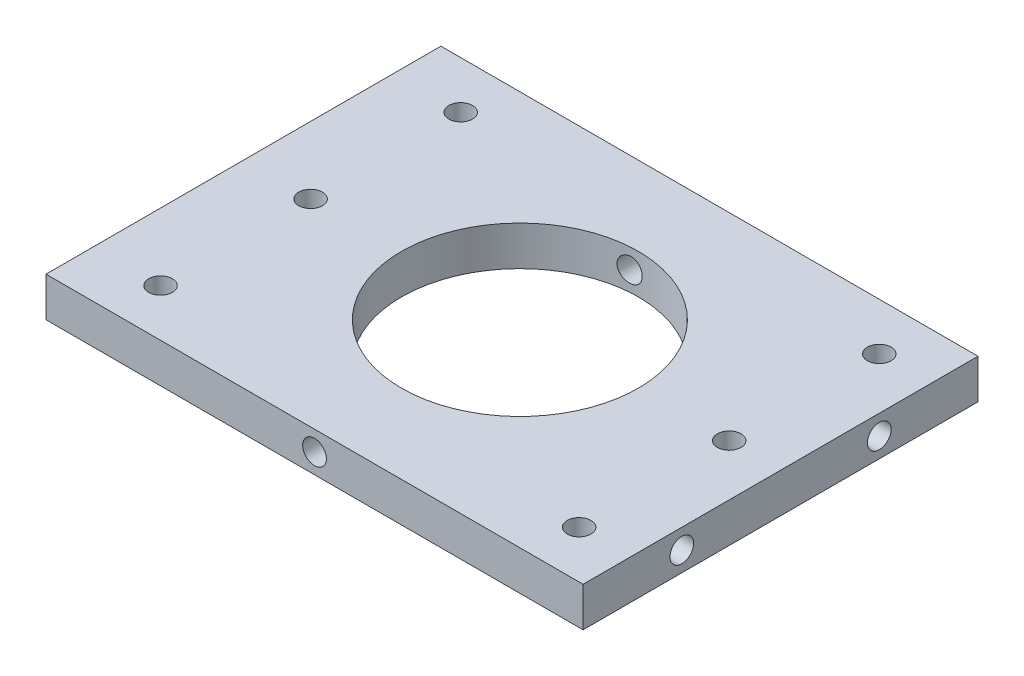
from build123d import *

# Parameters (mm, degrees)
ESQUISSE1_W             = 68
ESQUISSE1_H             = 5
BOSS_EXTRU_1_DEPTH      = 50
ESQUISSE2_R             = 15
ESQUISSE2_R_2           = 1.5
ENL_V_MAT_EXTRU_1_DEPTH = 73.672209269
ESQUISSE3_R             = 1.5
ENL_V_MAT_EXTRU_2_DEPTH = 10
ENL_V_START             = -10
ESQUISSE4_R             = 1.5
ENL_V_MAT_EXTRU_3_DEPTH = 10
ESQUISSE5_R             = 1.5
ENL_V_MAT_EXTRU_4_DEPTH = 89.069574769


with BuildPart() as part:
    # Esquisse1 → Boss.-Extru.1 (new body)
    with BuildSketch(Plane.XY):
        with Locations((18.5, -47.5)):
            Rectangle(ESQUISSE1_W, ESQUISSE1_H)
    extrude(amount=BOSS_EXTRU_1_DEPTH)

    # Esquisse2 → Enlèv. mat.-Extru.1 (cut, through all)
    with BuildSketch(Plane(origin=(0, -45, 0), x_dir=(-1, 0, 0), z_dir=(0, 1, 0))):
        with Locations((-19.5, 25)):
            Circle(ESQUISSE2_R)
        with Locations((-46, 44)):
            Circle(ESQUISSE2_R_2)
        with Locations((-46, 6)):
            Circle(ESQUISSE2_R_2)
        with Locations((7, 44)):
            Circle(ESQUISSE2_R_2)
        with Locations((7, 6)):
            Circle(ESQUISSE2_R_2)
        with Locations((7, 25)):
            Circle(ESQUISSE2_R_2)
        with Locations((-46, 25)):
            Circle(ESQUISSE2_R_2)
    extrude(amount=-ENL_V_MAT_EXTRU_1_DEPTH, mode=Mode.SUBTRACT)

    # Esquisse3 → Enlèv. mat.-Extru.2 (cut)
    with BuildSketch(Plane.ZY.offset(15.5)):
        with Locations((12.5, -47.5)):
            Circle(ESQUISSE3_R)
        with Locations((37.5, -47.5)):
            Circle(ESQUISSE3_R)
    extrude(amount=-ENL_V_MAT_EXTRU_2_DEPTH, mode=Mode.SUBTRACT)

    # Esquisse4 → Enlèv. mat.-Extru.3 (cut)
    with BuildSketch(Plane(origin=(52.5, 0, 0), x_dir=(0, 0, -1), z_dir=(1, 0, 0)).offset(ENL_V_START)):
        with Locations((-37.5, -47.5)):
            Circle(ESQUISSE4_R)
        with Locations((-12.5, -47.5)):
            Circle(ESQUISSE4_R)
    extrude(amount=ENL_V_MAT_EXTRU_3_DEPTH, mode=Mode.SUBTRACT)

    # Esquisse5 → Enlèv. mat.-Extru.4 (cut, through all)
    with BuildSketch(Plane.XY.offset(50)):
        with Locations((18.5, -47.5)):
            Circle(ESQUISSE5_R)
    extrude(amount=-ENL_V_MAT_EXTRU_4_DEPTH, mode=Mode.SUBTRACT)


solid = part.part
